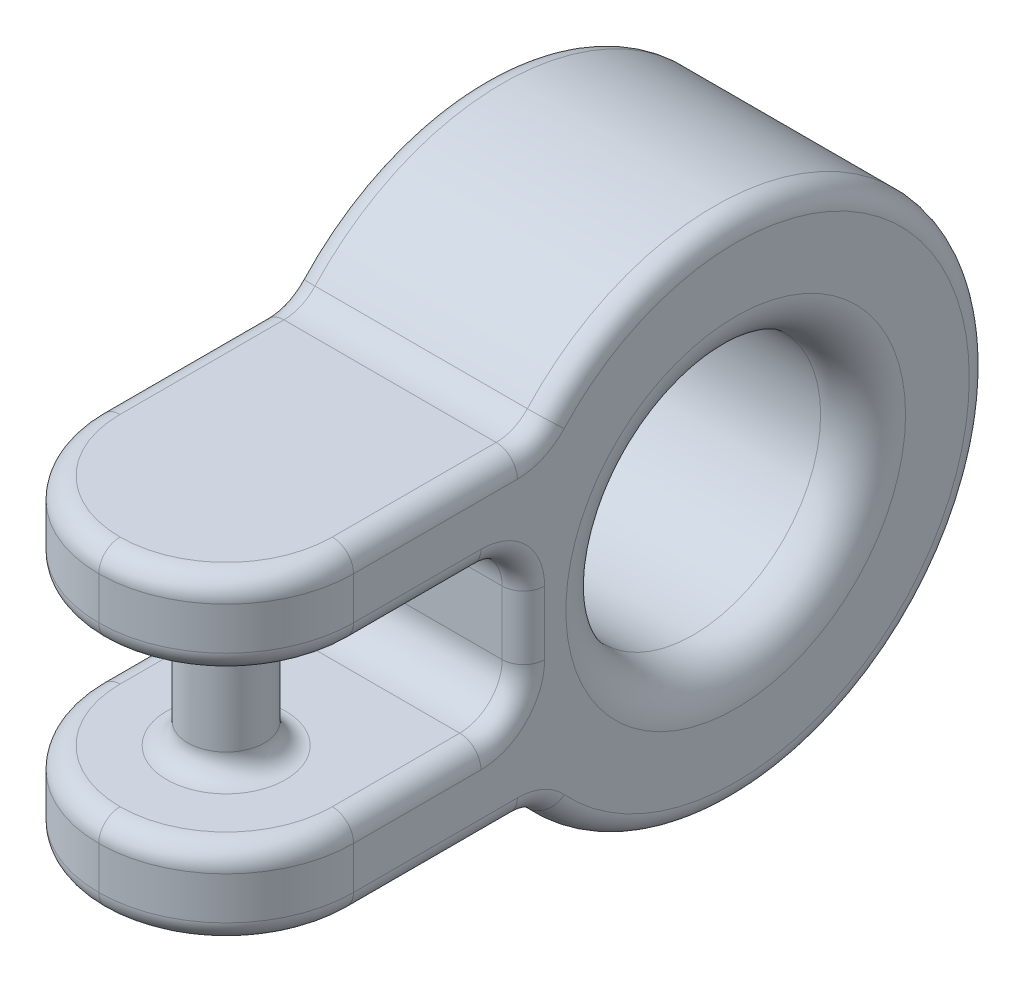
from build123d import *

# Parameters (mm, degrees)
SKETCH_1_R      = 3
EXTRUDE_1_DEPTH = 3
FILLET_1_R      = 1
EXTRUDE_2_REACH = 16.597
SKETCH_2_R      = 0.9
FILLET_3_R      = 1
FILLET_2_R      = 3
FILLET_4_R      = 0.5
FILLET_5_R      = 0.5


with BuildPart() as part:
    # 草图1 → 凸台-拉伸1 (new, symmetric)
    with BuildSketch(Plane(origin=(0, 0, 0), x_dir=(0, 0, -1), z_dir=(1, 0, 0))):
        with BuildLine():
            Line((-4.683748499, 3.75), (-12, 3.75))
            Line((-12, 3.75), (-12, 1.75))
            Line((-12, 1.75), (-5, 1.75))
            Line((-5, 1.75), (-5, -1.75))
            Line((-5, -1.75), (-12, -1.75))
            Line((-12, -1.75), (-12, -3.75))
            Line((-12, -3.75), (-4.683748499, -3.75))
            ThreePointArc((-4.683748499, -3.75), (6, 0), (-4.683748499, 3.75))
        make_face()
        Circle(SKETCH_1_R, mode=Mode.SUBTRACT)
    extrude(amount=EXTRUDE_1_DEPTH, both=True)

    # 圆角1
    fillet_1_edges = [part.edges().sort_by_distance(p)[0] for p in [
        (0, -3.75, 4.683748499),
        (0, -1.75, 5),
        (0, 1.75, 5),
        (0, 3.75, 4.683748499),
    ]]
    fillet(fillet_1_edges, radius=FILLET_1_R)

    # 草图2 → 凸台-拉伸2 (add, up to next)
    with BuildSketch(Plane(origin=(0, -1.75, 0), x_dir=(1, 0, 0), z_dir=(0, 1, 0)), mode=Mode.PRIVATE) as extrude_2_sk1:
        with Locations(Location((0, -9, 0), (0, 0, 90))):
            Circle(SKETCH_2_R)
    extrude_2_tool1 = extrude(extrude_2_sk1.sketch, amount=EXTRUDE_2_REACH, mode=Mode.PRIVATE) - part.part
    add(extrude_2_tool1.solids().sort_by_distance((0, -1.75, 9))[0])

    # 圆角3
    fillet_3_edges = [part.edges().sort_by_distance(p)[0] for p in [
        (-3, 0, 3),
        (3, 0, 3),
    ]]
    fillet(fillet_3_edges, radius=FILLET_3_R)

    # 圆角2
    fillet_2_edges = [part.edges().sort_by_distance(p)[0] for p in [
        (-3, -2.75, 12),
        (-3, 2.75, 12),
        (3, -2.75, 12),
        (3, 2.75, 12),
    ]]
    fillet(fillet_2_edges, radius=FILLET_2_R - 0.0001)  # a hair under: the kernel refuses the full size

    # 圆角4
    fillet_4_edges = [part.edges().sort_by_distance(p)[0] for p in [
        (0, -1.75, 9.9),
        (0, 1.75, 9.9),
    ]]
    fillet(fillet_4_edges, radius=FILLET_4_R)

    # 圆角5
    fillet_5_edges = [part.edges().sort_by_distance(p)[0] for p in [
        (-3, 3.75, 7.070920475),
        (3, 3.75, 7.070920475),
        (-3, 0, -6),
        (3, 0, -6),
        (-3, -1.75, 7.50005),
        (3, -1.75, 7.50005),
        (-3, 0, 5),
        (3, 0, 5),
        (-3, 3.833874619, 4.740849087),
        (3, 3.833874619, 4.740849087),
        (-3, -1.457106781, 5.292893219),
        (3, -1.457106781, 5.292893219),
        (-3, -3.833874619, 4.740849087),
        (3, -3.833874619, 4.740849087),
        (-3, 1.457106781, 5.292893219),
        (3, 1.457106781, 5.292893219),
        (-3, -3.75, 7.070920475),
        (3, -3.75, 7.070920475),
        (2.121349633, -3.75, 11.121349633),
        (-2.121349633, -3.75, 11.121349633),
        (-3, 1.75, 7.50005),
        (2.121349633, -1.75, 11.121349633),
        (-2.121349633, -1.75, 11.121349633),
        (3, 1.75, 7.50005),
        (2.121349633, 1.75, 11.121349633),
        (-2.121349633, 1.75, 11.121349633),
        (2.121349633, 3.75, 11.121349633),
        (-2.121349633, 3.75, 11.121349633),
    ]]
    fillet(fillet_5_edges, radius=FILLET_5_R)


solid = part.part
